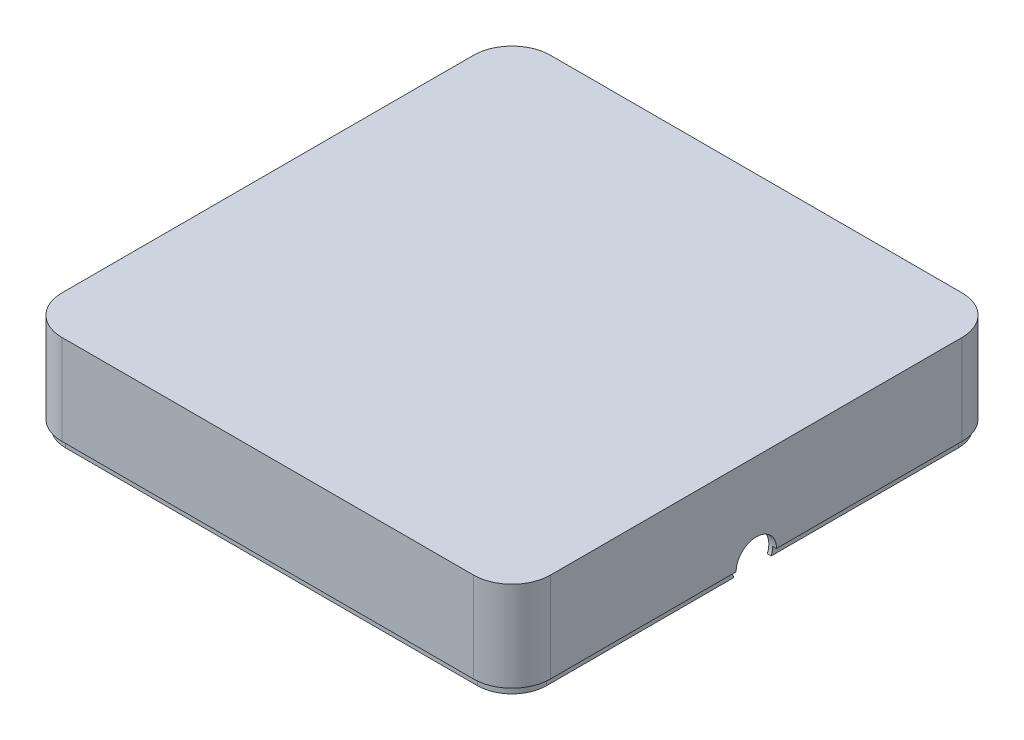
from build123d import *

# Parameters (mm, degrees)
SKETCH1_W           = 127
SKETCH1_H           = 25.4
BOSS_EXTRUDE1_DEPTH = 127
FILLET1_R           = 10
SHELL1_T            = -2
CUT_EXTRUDE1_DEPTH  = 2
SKETCH5_R           = 5.25
CUT_EXTRUDE3_DEPTH  = 4
CUT_EXTRUDE4_REACH  = 183.392
SKETCH6_W           = 15
SKETCH6_H           = 35


with BuildPart() as part:
    # Sketch1 → Boss-Extrude1 (new body)
    with BuildSketch(Plane.XY):
        with Locations((63.5, -12.7)):
            Rectangle(SKETCH1_W, SKETCH1_H)
    extrude(amount=BOSS_EXTRUDE1_DEPTH)

    # Fillet1
    fillet1_edges = [part.edges().sort_by_distance(p)[0] for p in [
        (0, -12.7, 127),
        (0, -12.7, 0),
        (127, -12.7, 0),
        (127, -12.7, 127),
    ]]
    fillet(fillet1_edges, radius=FILLET1_R)

    # Shell1
    shell1_openings = [part.faces().sort_by_distance(p)[0] for p in [
        (63.5, -25.4, 63.5),
    ]]
    offset(amount=SHELL1_T, openings=shell1_openings, kind=Kind.INTERSECTION)

    # Sketch3 → Cut-Extrude1 (cut)
    with BuildSketch(Plane.XZ.offset(25.4)):
        with BuildLine():
            Line((117, 127), (10, 127))
            ThreePointArc((10, 127), (2.928932188, 124.071067812), (0, 117))
            Line((0, 117), (0, 10))
            ThreePointArc((0, 10), (2.928932188, 2.928932188), (10, 0))
            Line((10, 0), (117, 0))
            ThreePointArc((117, 0), (124.071067812, 2.928932188), (127, 10))
            Line((127, 10), (127, 117))
            ThreePointArc((127, 117), (124.071067812, 124.071067812), (117, 127))
        make_face()
        with BuildLine():
            Line((117, 126), (10, 126))
            ThreePointArc((10, 126), (3.636038969, 123.363961031), (1, 117))
            Line((1, 117), (1, 10))
            ThreePointArc((1, 10), (3.636038969, 3.636038969), (10, 1))
            Line((10, 1), (117, 1))
            ThreePointArc((117, 1), (123.363961031, 3.636038969), (126, 10))
            Line((126, 10), (126, 117))
            ThreePointArc((126, 117), (123.363961031, 123.363961031), (117, 126))
        make_face(mode=Mode.SUBTRACT)
    extrude(amount=-CUT_EXTRUDE1_DEPTH, mode=Mode.SUBTRACT)

    # Sketch5 → Cut-Extrude3 (cut)
    with BuildSketch(Plane(origin=(127, 0, 0), x_dir=(0, 0, -1), z_dir=(1, 0, 0))):
        with Locations((-63.5, -23.4)):
            Circle(SKETCH5_R)
    extrude(amount=-CUT_EXTRUDE3_DEPTH, mode=Mode.SUBTRACT)

    # Sketch6 → Cut-Extrude4 (cut, up to next)
    with BuildSketch(Plane(origin=(0, 0, 0), x_dir=(-1, 0, 0), z_dir=(0, 0, -1)), mode=Mode.PRIVATE) as cut_extrude4_sk1:
        with Locations((-30.714826754, -25.107523405)):
            Rectangle(SKETCH6_W, SKETCH6_H)
    cut_extrude4_tool1 = extrude(cut_extrude4_sk1.sketch, amount=-CUT_EXTRUDE4_REACH, mode=Mode.PRIVATE) & part.part
    add(cut_extrude4_tool1.solids().sort_by_distance((30.714827, -25.107523, 0))[0], mode=Mode.SUBTRACT)


solid = part.part
